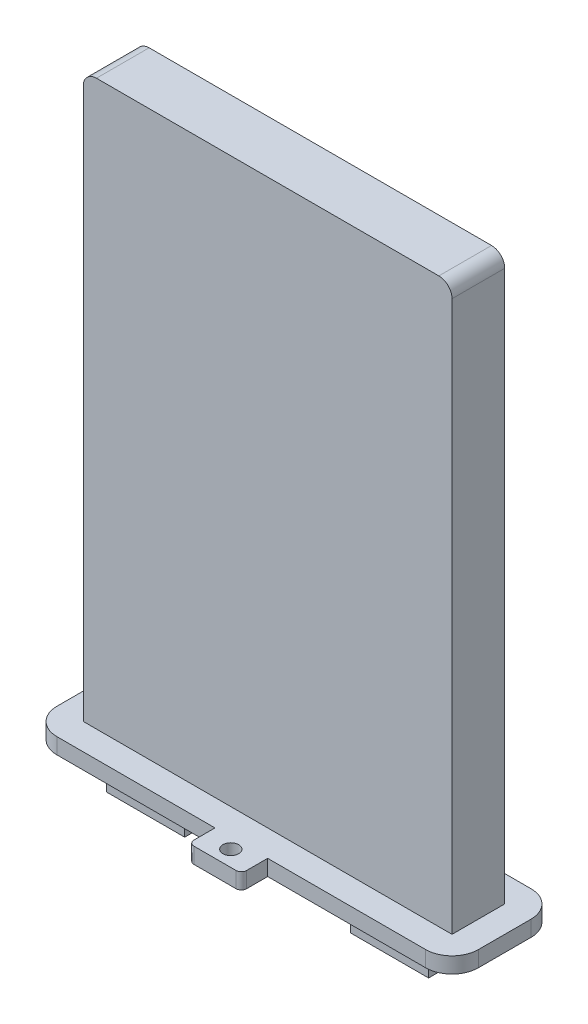
from build123d import *

# Parameters (mm, degrees)
SKETCH1_W           = 70
SKETCH1_H           = 110
BOSS_EXTRUDE1_DEPTH = 10
FILLET1_R           = 2.5
BOSS_EXTRUDE3_DEPTH = 10
SKETCH5_R           = 1.5
SKETCH5_W           = 70
SKETCH5_H           = 10
BOSS_EXTRUDE5_DEPTH = 3


with BuildPart() as part:
    # Sketch1 → Boss-Extrude1 (new body)
    with BuildSketch(Plane.XY):
        Rectangle(SKETCH1_W, SKETCH1_H)
    extrude(amount=BOSS_EXTRUDE1_DEPTH)

    # Fillet1
    fillet1_edges = [part.edges().sort_by_distance(p)[0] for p in [
        (35, 55, 5),
        (-35, 55, 5),
    ]]
    fillet(fillet1_edges, radius=FILLET1_R)

    # Sketch3 → Boss-Extrude3 (add)
    with BuildSketch(Plane(origin=(0, 0, 0), x_dir=(-1, 0, 0), z_dir=(0, 0, -1))):
        Polygon((-20.75, -58.6), (-15.75, -58.6), (-15.75, -61.4), (-30.55, -61.4), (-30.55, -58.6), (-25.55, -58.6), (-25.55, -55), (-20.75, -55), align=None)
        Polygon((30.55, -58.6), (30.55, -61.4), (15.75, -61.4), (15.75, -58.6), (20.75, -58.6), (20.75, -55), (25.55, -55), (25.55, -58.6), align=None)
    extrude(amount=-BOSS_EXTRUDE3_DEPTH)

    # Sketch5 → Boss-Extrude5 (add)
    with BuildSketch(Plane.XZ.offset(55)):
        with BuildLine():
            Line((5, -5), (35, -5))
            ThreePointArc((35, -5), (38.535533906, -3.535533906), (40, 0))
            Line((40, 0), (40, 10))
            ThreePointArc((40, 10), (38.535533906, 13.535533906), (35, 15))
            Line((35, 15), (5, 15))
            Line((5, 15), (5, 19))
            ThreePointArc((5, 19), (4.707106781, 19.707106781), (4, 20))
            Line((4, 20), (-4, 20))
            ThreePointArc((-4, 20), (-4.707106781, 19.707106781), (-5, 19))
            Line((-5, 19), (-5, 15))
            Line((-5, 15), (-35, 15))
            ThreePointArc((-35, 15), (-38.535533906, 13.535533906), (-40, 10))
            Line((-40, 10), (-40, 0))
            ThreePointArc((-40, 0), (-38.535533906, -3.535533906), (-35, -5))
            Line((-35, -5), (-5, -5))
            Line((-5, -5), (-5, -9))
            ThreePointArc((-5, -9), (-4.707106781, -9.707106781), (-4, -10))
            Line((-4, -10), (4, -10))
            ThreePointArc((4, -10), (4.707106781, -9.707106781), (5, -9))
            Line((5, -9), (5, -5))
        make_face()
        with Locations((0, -7)):
            Circle(SKETCH5_R, mode=Mode.SUBTRACT)
        with Locations((0, 17)):
            Circle(SKETCH5_R, mode=Mode.SUBTRACT)
        with Locations((0, 5)):
            Rectangle(SKETCH5_W, SKETCH5_H, mode=Mode.SUBTRACT)
    extrude(amount=-BOSS_EXTRUDE5_DEPTH)


solid = part.part
